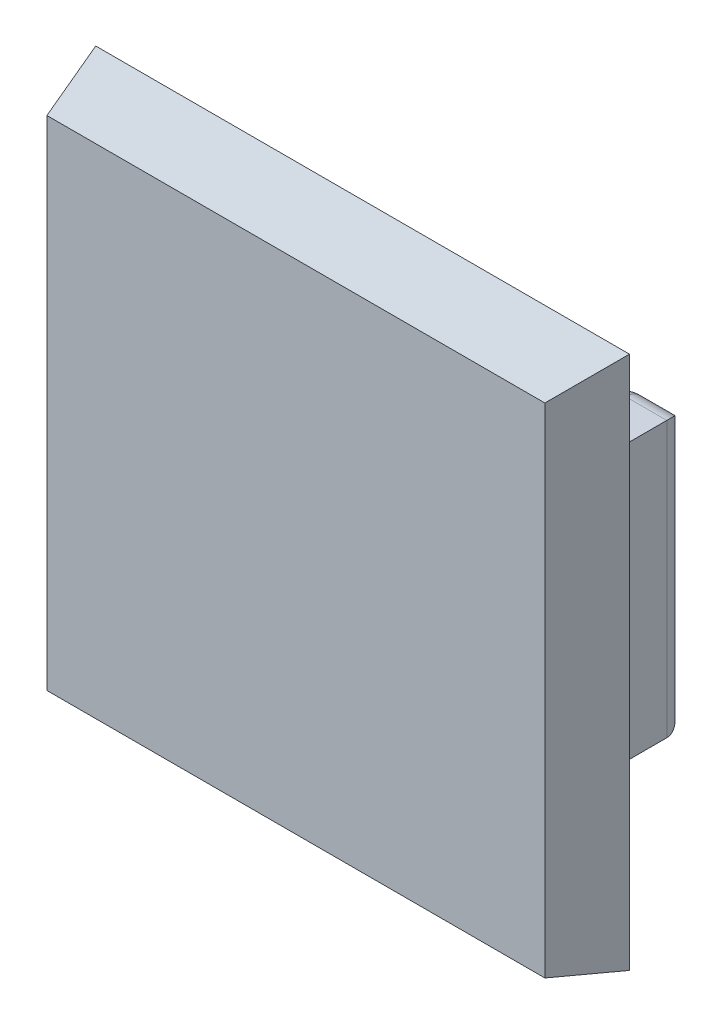
from build123d import *

# Parameters (mm, degrees)
SKETCH1_W               = 20
SKETCH1_H               = 20
BOSS_EXTRUDE1_DEPTH     = 2.5
BOSS_EXTRUDE1_TAPER     = 15
SKETCH2_W               = 18
SKETCH2_H               = 18
CUT_EXTRUDE1_DEPTH      = 0.85
SKETCH3_R               = 2
BOSS_EXTRUDE2_DEPTH     = 8.2
BOSS_EXTRUDE2_TAPER     = 1.5
CHAMFER1_SIZE           = 2
CHAMFER1_SIZE_2         = 0.5
FILLET1_R               = 0.5
SKETCH4_W               = 0.5
SKETCH4_H               = 6.160058372
SKETCH4_W_2             = 6.292216955
SKETCH4_H_2             = 0.5
CUT_EXTRUDE_THIN1_DEPTH = 8.2
CUT_EXTRUDE_THIN1_TAPER = 1
BOSS_EXTRUDE3_DEPTH     = 5
FILLET2_R               = 1
FILLET3_R               = 0.75
CUT_EXTRUDE2_DEPTH      = 5
FILLET2_OF_MIRROR1_R    = 1
FILLET3_OF_MIRROR1_R    = 0.75


with BuildPart() as part:
    # Sketch1 → Boss-Extrude1 (new body)
    with BuildSketch(Plane.XY):
        Rectangle(SKETCH1_W, SKETCH1_H)
    extrude(amount=BOSS_EXTRUDE1_DEPTH, taper=BOSS_EXTRUDE1_TAPER)

    # Sketch2 → Cut-Extrude1 (cut)
    with BuildSketch(Plane(origin=(0, 0, 0), x_dir=(-1, 0, 0), z_dir=(0, 0, -1))):
        Rectangle(SKETCH2_W, SKETCH2_H)
    extrude(amount=-CUT_EXTRUDE1_DEPTH, mode=Mode.SUBTRACT)

    # Sketch3 → Boss-Extrude2 (add)
    with BuildSketch(Plane(origin=(0, 0, 0.85), x_dir=(-1, 0, 0), z_dir=(0, 0, -1))):
        Circle(SKETCH3_R)
    extrude(amount=BOSS_EXTRUDE2_DEPTH, taper=BOSS_EXTRUDE2_TAPER)

    # Chamfer1
    # the kernel refuses this chamfer: 2, 0.5 mm, written as the material it takes off along each edge
    with BuildSketch(Plane(origin=(0, 0, -7.35), x_dir=(-1, 0, 0), z_dir=(0, 1, 0))) as chamfer1_piece_1:
        Polygon((1.785275443 + CHAMFER1_SIZE * 0.0261769483079, CHAMFER1_SIZE * 0.999657324976), (1.785275443 - CHAMFER1_SIZE_2, 0), (1.785275443, 0), align=None)
    revolve(axis=Axis((0, 0, -7.35), (0, 0, 1)), mode=Mode.SUBTRACT)

    # Fillet1
    fillet1_edges = [part.edges().sort_by_distance(p)[0] for p in [
        (1.285275443, 0, -7.35),
        (1.83762934, 0, -5.35068535),
    ]]
    fillet(fillet1_edges, radius=FILLET1_R)

    # Sketch4 → Cut-Extrude-Thin1 (cut)
    with BuildSketch(Plane(origin=(0, 0, -7.35), x_dir=(-1, 0, 0), z_dir=(0, 0, -1))):
        with Locations((0, 0.055971591)):
            Rectangle(SKETCH4_W, SKETCH4_H)
        with Locations((0.111262179, 0)):
            Rectangle(SKETCH4_W_2, SKETCH4_H_2)
    extrude(amount=-CUT_EXTRUDE_THIN1_DEPTH, taper=CUT_EXTRUDE_THIN1_TAPER, mode=Mode.SUBTRACT)

    # Sketch5 → Boss-Extrude3 (add)
    with BuildSketch(Plane(origin=(0, 0, 0.85), x_dir=(-1, 0, 0), z_dir=(0, 0, -1))):
        Polygon((4, 2.8), (4, -2.8), (6, -5.15), (8, -5.15), (8, 5.15), (6, 5.15), align=None)
    boss_extrude3 = extrude(amount=BOSS_EXTRUDE3_DEPTH)

    # Fillet2
    fillet2_edges = [part.edges().sort_by_distance(p)[0] for p in [
        (-6, -5.15, -1.65),
        (-6, 5.15, -1.65),
        (-4, 2.8, -1.65),
        (-4, -2.8, -1.65),
    ]]
    fillet(fillet2_edges, radius=FILLET2_R)

    # Fillet3
    fillet3_edges = [part.edges().sort_by_distance(p)[0] for p in [
        (-8, 0, -4.15),
        (-7.231032941, 5.15, -4.15),
        (-4.969493552, 3.939154923, -4.15),
        (-7.231032941, -5.15, -4.15),
        (-4, 0, -4.15),
        (-4.969493552, -3.939154923, -4.15),
        (-4.061506689, -2.777370003, -4.15),
        (-6.042613043, -5.057777128, -4.15),
        (-4.061506689, 2.777370003, -4.15),
        (-6.042613043, 5.057777128, -4.15),
    ]]
    fillet(fillet3_edges, radius=FILLET3_R)

    # Sketch6 → Cut-Extrude2 (cut)
    with BuildSketch(Plane(origin=(0, 0, -4.15), x_dir=(-1, 0, 0), z_dir=(0, 0, -1))):
        Polygon((7, -4.15), (7, 4.15), (6.462065883, 4.15), (5, 2.432072588), (5, -2.432072588), (6.462065883, -4.15), align=None)
    cut_extrude2 = extrude(amount=-CUT_EXTRUDE2_DEPTH, mode=Mode.SUBTRACT)

    # Mirror1: Boss-Extrude3, Cut-Extrude2 across plane
    add(boss_extrude3.mirror(Plane(origin=(0, 0, 0), x_dir=(0, 0, 1), z_dir=(1, 0, 0))))
    add(cut_extrude2.mirror(Plane(origin=(0, 0, 0), x_dir=(0, 0, 1), z_dir=(1, 0, 0))), mode=Mode.SUBTRACT)

    # Fillet2 of Mirror1
    fillet2_of_mirror1_edges = [part.edges().sort_by_distance(p)[0] for p in [
        (6, -5.15, -1.65),
        (6, 5.15, -1.65),
        (4, 2.8, -1.65),
        (4, -2.8, -1.65),
    ]]
    fillet(fillet2_of_mirror1_edges, radius=FILLET2_OF_MIRROR1_R)

    # Fillet3 of Mirror1
    fillet3_of_mirror1_edges = [part.edges().sort_by_distance(p)[0] for p in [
        (8, 0, -4.15),
        (7.231032941, 5.15, -4.15),
        (4.969493552, 3.939154923, -4.15),
        (7.231032941, -5.15, -4.15),
        (4, 0, -4.15),
        (4.969493552, -3.939154923, -4.15),
        (4.061506689, -2.777370003, -4.15),
        (6.042613043, -5.057777128, -4.15),
        (4.061506689, 2.777370003, -4.15),
        (6.042613043, 5.057777128, -4.15),
    ]]
    fillet(fillet3_of_mirror1_edges, radius=FILLET3_OF_MIRROR1_R)


solid = part.part
